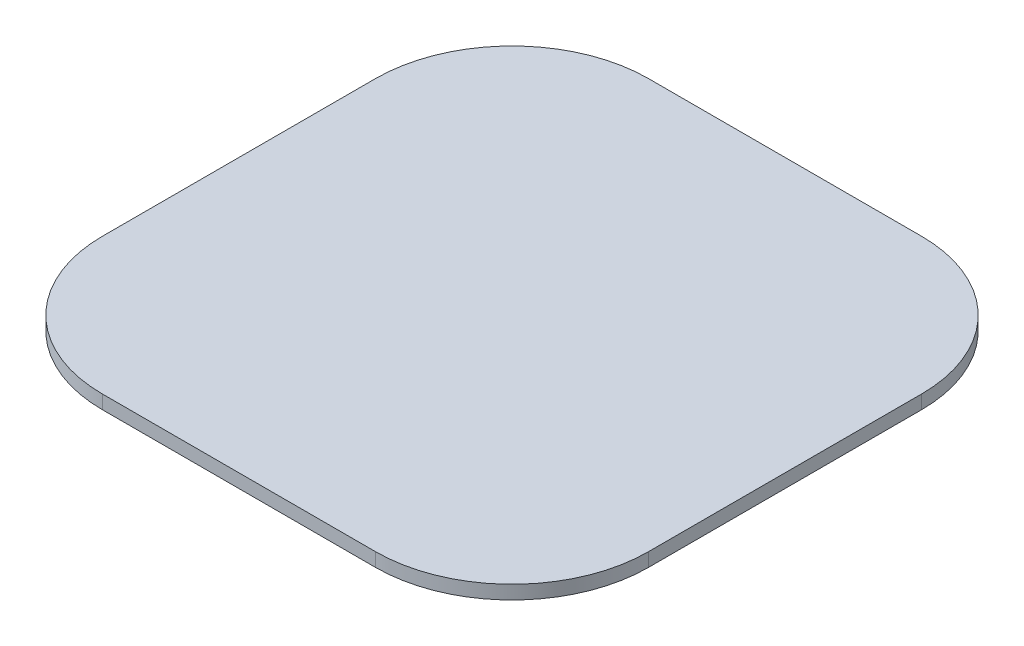
from build123d import *

# Parameters (mm, degrees)
SKETCH1_W           = 254
SKETCH1_H           = 254
BOSS_EXTRUDE1_DEPTH = 6.35
CUT_EXTRUDE1_DEPTH  = 180.717340566


with BuildPart() as part:
    # Sketch1 → Boss-Extrude1 (new body)
    with BuildSketch(Plane(origin=(0, 0, 0), x_dir=(1, 0, 0), z_dir=(0, 1, 0))):
        Rectangle(SKETCH1_W, SKETCH1_H)
    extrude(amount=BOSS_EXTRUDE1_DEPTH)

    # Sketch2 → Cut-Extrude1 (cut, through all)
    with BuildSketch(Plane(origin=(0, 6.35, 0), x_dir=(1, 0, 0), z_dir=(0, 1, 0))):
        with BuildLine():
            Line((-127, -127), (-127, -63.5))
            ThreePointArc((-127, -63.5), (-108.401280605, -108.401280605), (-63.5, -127))
            Line((-63.5, -127), (-127, -127))
        make_face()
        with BuildLine():
            Line((63.5, -127), (127, -127))
            Line((127, -127), (127, -63.5))
            ThreePointArc((127, -63.5), (108.401280605, -108.401280605), (63.5, -127))
        make_face()
        with BuildLine():
            Line((127, 63.5), (127, 127))
            Line((127, 127), (63.5, 127))
            ThreePointArc((63.5, 127), (108.401280605, 108.401280605), (127, 63.5))
        make_face()
        with BuildLine():
            Line((-63.5, 127), (-127, 127))
            Line((-127, 127), (-127, 63.5))
            ThreePointArc((-127, 63.5), (-108.401280605, 108.401280605), (-63.5, 127))
        make_face()
    extrude(amount=-CUT_EXTRUDE1_DEPTH, mode=Mode.SUBTRACT)


solid = part.part
